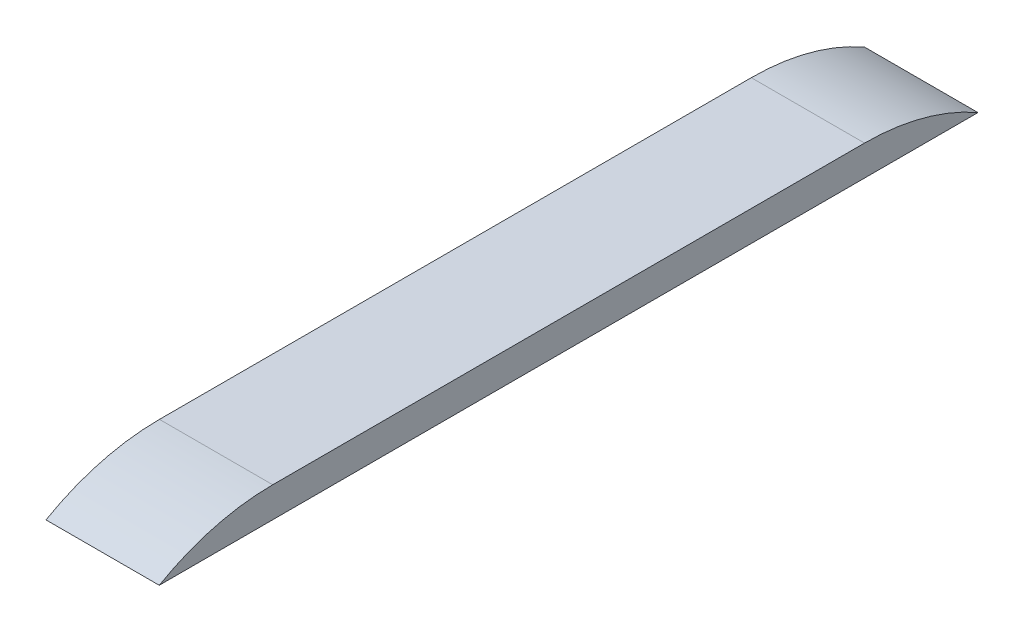
from build123d import *

# Parameters (mm, degrees)
SKETCH_1_W      = 7.47
SKETCH_1_H      = 54
EXTRUDE_1_DEPTH = 2
FILLET_1_R      = 15
FILLET_2_R      = 15


with BuildPart() as part:
    # Эскиз1 → Бобышка-Вытянуть1 (new body)
    with BuildSketch(Plane(origin=(0, 0, 0), x_dir=(1, 0, 0), z_dir=(0, 1, 0))):
        Rectangle(SKETCH_1_W, SKETCH_1_H)
    extrude(amount=EXTRUDE_1_DEPTH)

    # Скругление1
    # the kernel refuses this fillet: 15 mm, written as the material it takes off along each edge
    with BuildSketch(Plane(origin=(22.443286934, 2, 27), x_dir=(0, -1, 0), z_dir=(-1, 0, 0))) as fillet_1_piece_1:
        with BuildLine():
            CenterArc((15, -7.483314774), FILLET_1_R, 150.073565133, 29.926434867)
            Line((0, -7.483314774), (-0.3, -7.483314774))
            Line((-0.3, -7.483314774), (-0.3, 0))
            Line((-0.3, 0), (0, 0.3))
            ThreePointArc((0, 0.3), (1, 0.3), (1.74, 0.149666295))
            Line((1.74, 0.149666295), (2, 0))
        make_face()
    extrude(amount=44.886573868, mode=Mode.SUBTRACT)

    # Скругление2
    # the kernel refuses this fillet: 15 mm, written as the material it takes off along each edge
    with BuildSketch(Plane(origin=(-22.443286934, 2, -27), x_dir=(0, -1, 0), z_dir=(1, 0, 0))) as fillet_2_piece_1:
        with BuildLine():
            CenterArc((15, -7.483314774), FILLET_2_R, 150.073565133, 29.926434867)
            Line((0, -7.483314774), (-0.3, -7.483314774))
            Line((-0.3, -7.483314774), (-0.3, 0))
            Line((-0.3, 0), (0, 0.3))
            ThreePointArc((0, 0.3), (1, 0.3), (1.74, 0.149666295))
            Line((1.74, 0.149666295), (2, 0))
        make_face()
    extrude(amount=44.886573868, mode=Mode.SUBTRACT)


solid = part.part
